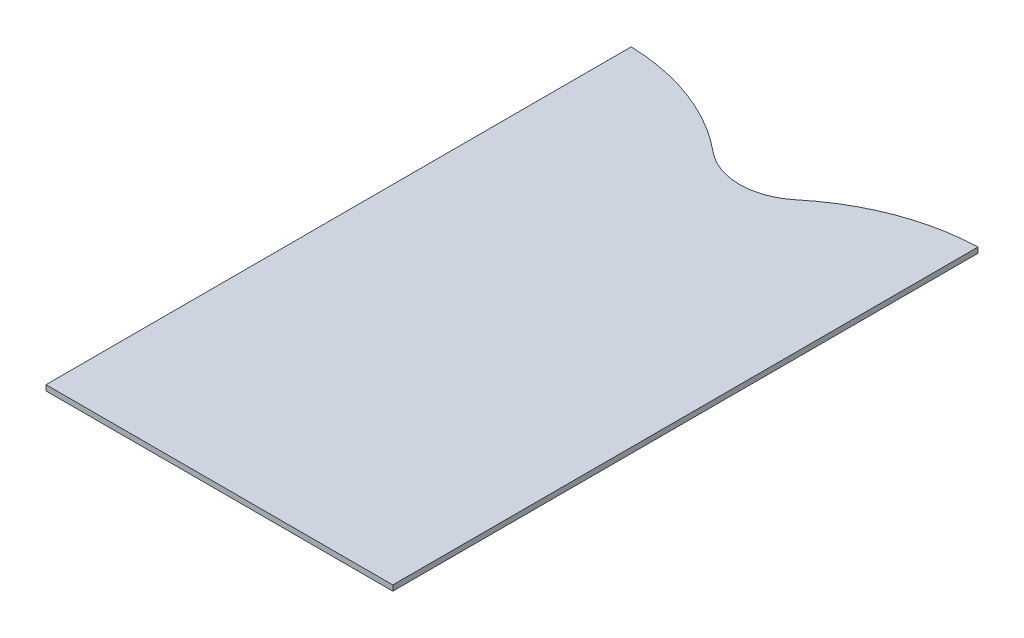
from build123d import *

# Parameters (mm, degrees)
SKETCH1_W           = 203.2
SKETCH1_H           = 342.9
BOSS_EXTRUDE1_DEPTH = 3.175
CUT_EXTRUDE1_DEPTH  = 200.31819567
FILLET1_R           = 127


with BuildPart() as part:
    # Sketch1 → Boss-Extrude1 (new body)
    with BuildSketch(Plane(origin=(0, 0, 0), x_dir=(1, 0, 0), z_dir=(0, 1, 0))):
        Rectangle(SKETCH1_W, SKETCH1_H)
    extrude(amount=BOSS_EXTRUDE1_DEPTH)

    # Sketch2 → Cut-Extrude1 (cut, through all)
    with BuildSketch(Plane(origin=(0, 3.175, 0), x_dir=(1, 0, 0), z_dir=(0, 1, 0))):
        with BuildLine():
            ThreePointArc((-38.1, 171.45), (0, 133.35), (38.1, 171.45))
            Line((38.1, 171.45), (-38.1, 171.45))
        make_face()
    extrude(amount=-CUT_EXTRUDE1_DEPTH, mode=Mode.SUBTRACT)

    # Fillet1
    # the kernel refuses this fillet: 127 mm, written as the material it takes off along each edge
    with BuildSketch(Plane(origin=(38.1, 161.925, -171.45), x_dir=(-0.42460388780422365, 0, 0.905379223564103), z_dir=(0, -1, 0))) as fillet1_piece_1:
        with BuildLine():
            CenterArc((86.279510002, -114.983161393), FILLET1_R, 115.12559338, 37.958028581)
            Line((-26.962346876, -57.491580696), (-29.227184013, -56.341749082))
            ThreePointArc((-29.227184013, -56.341749082), (-15.780836666, -27.667296473), (-2.299663228, 1.078493875))
            Line((-2.299663228, 1.078493875), (1.078493875, 2.299663228))
            ThreePointArc((1.078493875, 2.299663228), (16.177408125, -1.065051582), (31.276322376, 2.299663228))
            Line((31.276322376, 2.299663228), (32.354816251, 0))
        make_face()
    extrude(amount=320.675, mode=Mode.SUBTRACT)
    with BuildSketch(Plane(origin=(-38.1, 161.925, -171.45), x_dir=(-1, 0, 0), z_dir=(0, -1, 0))) as fillet1_piece_2:
        with BuildLine():
            CenterArc((67.46875, -126.937973134), FILLET1_R, 91.790784659, 37.958028581)
            Line((-13.737980769, -29.293378416), (-15.362115385, -27.340486521))
            ThreePointArc((-15.362115385, -27.340486521), (-5.90471481, -15.09891425), (-2.54, 0))
            Line((-2.54, 0), (0, 2.54))
            ThreePointArc((0, 2.54), (31.75, 2.54), (63.420625, 2.538759463))
            Line((63.420625, 2.538759463), (63.5, 0))
        make_face()
    extrude(amount=320.675, mode=Mode.SUBTRACT)


solid = part.part
